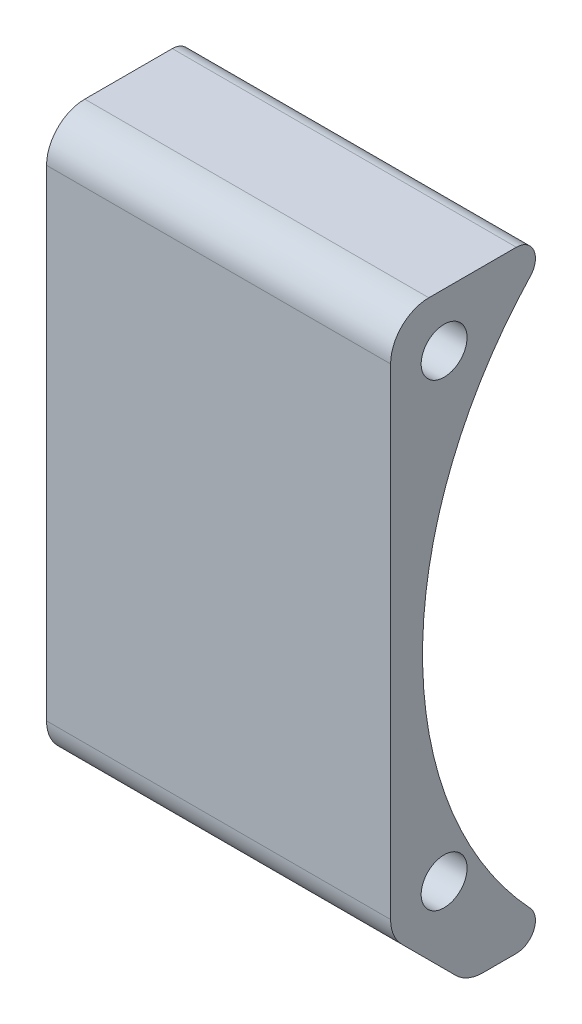
from build123d import *

# Parameters (mm, degrees)
BOSS_EXTRUDE1_DEPTH   = 28.575
CHAMFER1_SIZE         = 6.35
FILLET1_R             = 3.175
FILLET2_R             = 1.5875
F_8_CLEARANCE_HOLE1_D = 3.81
CUT_EXTRUDE1_DEPTH    = 6.35


with BuildPart() as part:
    # Sketch1 → Boss-Extrude1 (new body)
    with BuildSketch(Plane(origin=(0, 0, 0), x_dir=(0, 0, -1), z_dir=(1, 0, 0))):
        with BuildLine():
            Line((0, 0), (0, 50.8))
            Line((0, 50.8), (14.399754562, 50.8))
            ThreePointArc((14.399754562, 50.8), (2.654588994, 25.4), (14.399754562, 0))
            Line((14.399754562, 0), (0, 0))
        make_face()
    extrude(amount=BOSS_EXTRUDE1_DEPTH)

    # Chamfer1
    chamfer1_edges = [part.edges().sort_by_distance(p)[0] for p in [
        (14.2875, 0, 0),
    ]]
    chamfer(chamfer1_edges, length=CHAMFER1_SIZE)

    # Fillet1
    fillet1_edges = [part.edges().sort_by_distance(p)[0] for p in [
        (14.2875, 6.35, 0),
        (14.2875, 0, -6.35),
        (14.2875, 50.8, 0),
    ]]
    fillet(fillet1_edges, radius=FILLET1_R)

    # Fillet2
    fillet2_edges = [part.edges().sort_by_distance(p)[0] for p in [
        (14.2875, 50.8, -14.399754562),
        (14.2875, 0, -14.399754562),
    ]]
    fillet(fillet2_edges, radius=FILLET2_R)

    # #8 Clearance Hole1 (through all)
    with Locations(Plane(origin=(28.575, 0, 0), x_dir=(0, 0, -1), z_dir=(1, 0, 0))):
        with Locations((4.445, 46.355), (4.445, 8.191179285)):
            Hole(F_8_CLEARANCE_HOLE1_D / 2)

    # Sketch4 → Cut-Extrude1 (cut)
    with BuildSketch(Plane.ZY):
        with BuildLine():
            Line((-4.445, 49.53), (-11.999120339, 49.53))
            ThreePointArc((-11.999120339, 49.53), (-11.971783944, 48.782269306), (-11.604985018, 48.130113636))
            ThreePointArc((-11.604985018, 48.130113636), (-9.582122271, 45.744595447), (-7.791725411, 43.18))
            Line((-7.791725411, 43.18), (-4.445, 43.18))
            ThreePointArc((-4.445, 43.18), (-1.27, 46.355), (-4.445, 49.53))
        make_face()
        with BuildLine():
            Line((-4.445, 11.366179285), (-5.752367065, 11.366179285))
            ThreePointArc((-5.752367065, 11.366179285), (-7.50489081, 8.083289981), (-9.612385446, 5.016179285))
            Line((-9.612385446, 5.016179285), (-4.445, 5.016179285))
            ThreePointArc((-4.445, 5.016179285), (-1.27, 8.191179285), (-4.445, 11.366179285))
        make_face()
    extrude(amount=-CUT_EXTRUDE1_DEPTH, mode=Mode.SUBTRACT)


solid = part.part
